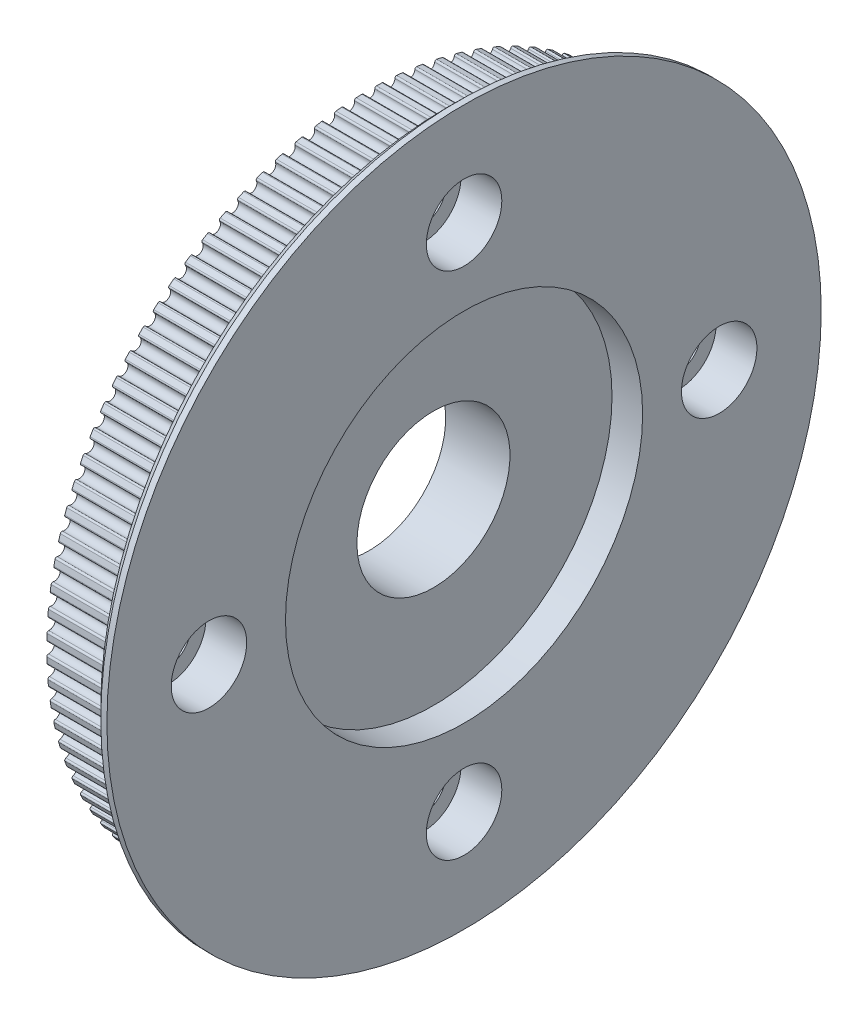
from build123d import *

# Parameters (mm, degrees)
SKETCH1_R           = 31.6
SKETCH1_R_2         = 7.5
BOSS_EXTRUDE1_DEPTH = 7.7
SKETCH2_R           = 0.55
CUT_EXTRUDE1_DEPTH  = 7.7
FILLET1_R           = 0.16
SKETCH3_R           = 35
SKETCH3_R_2         = 7.5
BOSS_EXTRUDE2_DEPTH = 1.6
SKETCH6_R           = 2.2
CUT_EXTRUDE6_DEPTH  = 9.3
SKETCH7_R           = 3.7
CUT_EXTRUDE4_DEPTH  = 4
CHAMFER1_SIZE       = 1
SKETCH8_R           = 17.5
CUT_EXTRUDE7_DEPTH  = 3


with BuildPart() as part:
    # Sketch1 → Boss-Extrude1 (new body)
    with BuildSketch(Plane(origin=(0, 0, 0), x_dir=(0, 0, -1), z_dir=(1, 0, 0))):
        with Locations(Location((0, 0, 0), (0, 0, 180))):
            Circle(SKETCH1_R)
        with Locations(Location((0, 0, 0), (0, 0, 180))):
            Circle(SKETCH1_R_2, mode=Mode.SUBTRACT)
    extrude(amount=BOSS_EXTRUDE1_DEPTH)

    # Sketch2 → Cut-Extrude1 (cut)
    with BuildSketch(Plane(origin=(0, 0, 0), x_dir=(0, 0, -1), z_dir=(1, 0, 0))):
        with Locations((0, 31.39)):
            Circle(SKETCH2_R)
        with Locations((1.970994408, 31.328059005)):
            Circle(SKETCH2_R)
        with Locations((3.934210202, 31.142480474)):
            Circle(SKETCH2_R)
        with Locations((5.881899465, 30.8339968)):
            Circle(SKETCH2_R)
        with Locations((7.806375558, 30.403825428)):
            Circle(SKETCH2_R)
        with Locations((9.700043453, 29.853664047)):
            Circle(SKETCH2_R)
        with Locations((11.555429709, 29.185683892)):
            Circle(SKETCH2_R)
        with Locations((13.365211962, 28.402521177)):
            Circle(SKETCH2_R)
        with Locations((15.12224783, 27.507266687)):
            Circle(SKETCH2_R)
        with Locations((16.819603094, 26.503453582)):
            Circle(SKETCH2_R)
        with Locations((18.450579069, 25.395043453)):
            Circle(SKETCH2_R)
        with Locations((20.008739038, 24.186410691)):
            Circle(SKETCH2_R)
        with Locations((21.487933655, 22.882325215)):
            Circle(SKETCH2_R)
        with Locations((22.882325215, 21.487933655)):
            Circle(SKETCH2_R)
        with Locations((24.186410691, 20.008739038)):
            Circle(SKETCH2_R)
        with Locations((25.395043453, 18.450579069)):
            Circle(SKETCH2_R)
        with Locations((26.503453582, 16.819603094)):
            Circle(SKETCH2_R)
        with Locations((27.507266687, 15.12224783)):
            Circle(SKETCH2_R)
        with Locations((28.402521177, 13.365211962)):
            Circle(SKETCH2_R)
        with Locations((29.185683892, 11.555429709)):
            Circle(SKETCH2_R)
        with Locations((29.853664047, 9.700043453)):
            Circle(SKETCH2_R)
        with Locations((30.403825428, 7.806375558)):
            Circle(SKETCH2_R)
        with Locations((30.8339968, 5.881899465)):
            Circle(SKETCH2_R)
        with Locations((31.142480474, 3.934210202)):
            Circle(SKETCH2_R)
        with Locations((31.328059005, 1.970994408)):
            Circle(SKETCH2_R)
        with Locations((31.39, 0)):
            Circle(SKETCH2_R)
        with Locations((31.328059005, -1.970994408)):
            Circle(SKETCH2_R)
        with Locations((31.142480474, -3.934210202)):
            Circle(SKETCH2_R)
        with Locations((30.8339968, -5.881899465)):
            Circle(SKETCH2_R)
        with Locations((30.403825428, -7.806375558)):
            Circle(SKETCH2_R)
        with Locations((29.853664047, -9.700043453)):
            Circle(SKETCH2_R)
        with Locations((29.185683892, -11.555429709)):
            Circle(SKETCH2_R)
        with Locations((28.402521177, -13.365211962)):
            Circle(SKETCH2_R)
        with Locations((27.507266687, -15.12224783)):
            Circle(SKETCH2_R)
        with Locations((26.503453582, -16.819603094)):
            Circle(SKETCH2_R)
        with Locations((25.395043453, -18.450579069)):
            Circle(SKETCH2_R)
        with Locations((24.186410691, -20.008739038)):
            Circle(SKETCH2_R)
        with Locations((22.882325215, -21.487933655)):
            Circle(SKETCH2_R)
        with Locations((21.487933655, -22.882325215)):
            Circle(SKETCH2_R)
        with Locations((20.008739038, -24.186410691)):
            Circle(SKETCH2_R)
        with Locations((18.450579069, -25.395043453)):
            Circle(SKETCH2_R)
        with Locations((16.819603094, -26.503453582)):
            Circle(SKETCH2_R)
        with Locations((15.12224783, -27.507266687)):
            Circle(SKETCH2_R)
        with Locations((13.365211962, -28.402521177)):
            Circle(SKETCH2_R)
        with Locations((11.555429709, -29.185683892)):
            Circle(SKETCH2_R)
        with Locations((9.700043453, -29.853664047)):
            Circle(SKETCH2_R)
        with Locations((7.806375558, -30.403825428)):
            Circle(SKETCH2_R)
        with Locations((5.881899465, -30.8339968)):
            Circle(SKETCH2_R)
        with Locations((3.934210202, -31.142480474)):
            Circle(SKETCH2_R)
        with Locations((1.970994408, -31.328059005)):
            Circle(SKETCH2_R)
        with Locations((0, -31.39)):
            Circle(SKETCH2_R)
        with Locations((-1.970994408, -31.328059005)):
            Circle(SKETCH2_R)
        with Locations((-3.934210202, -31.142480474)):
            Circle(SKETCH2_R)
        with Locations((-5.881899465, -30.8339968)):
            Circle(SKETCH2_R)
        with Locations((-7.806375558, -30.403825428)):
            Circle(SKETCH2_R)
        with Locations((-9.700043453, -29.853664047)):
            Circle(SKETCH2_R)
        with Locations((-11.555429709, -29.185683892)):
            Circle(SKETCH2_R)
        with Locations((-13.365211962, -28.402521177)):
            Circle(SKETCH2_R)
        with Locations((-15.12224783, -27.507266687)):
            Circle(SKETCH2_R)
        with Locations((-16.819603094, -26.503453582)):
            Circle(SKETCH2_R)
        with Locations((-18.450579069, -25.395043453)):
            Circle(SKETCH2_R)
        with Locations((-20.008739038, -24.186410691)):
            Circle(SKETCH2_R)
        with Locations((-21.487933655, -22.882325215)):
            Circle(SKETCH2_R)
        with Locations((-22.882325215, -21.487933655)):
            Circle(SKETCH2_R)
        with Locations((-24.186410691, -20.008739038)):
            Circle(SKETCH2_R)
        with Locations((-25.395043453, -18.450579069)):
            Circle(SKETCH2_R)
        with Locations((-26.503453582, -16.819603094)):
            Circle(SKETCH2_R)
        with Locations((-27.507266687, -15.12224783)):
            Circle(SKETCH2_R)
        with Locations((-28.402521177, -13.365211962)):
            Circle(SKETCH2_R)
        with Locations((-29.185683892, -11.555429709)):
            Circle(SKETCH2_R)
        with Locations((-29.853664047, -9.700043453)):
            Circle(SKETCH2_R)
        with Locations((-30.403825428, -7.806375558)):
            Circle(SKETCH2_R)
        with Locations((-30.8339968, -5.881899465)):
            Circle(SKETCH2_R)
        with Locations((-31.142480474, -3.934210202)):
            Circle(SKETCH2_R)
        with Locations((-31.328059005, -1.970994408)):
            Circle(SKETCH2_R)
        with Locations((-31.39, 0)):
            Circle(SKETCH2_R)
        with Locations((-31.328059005, 1.970994408)):
            Circle(SKETCH2_R)
        with Locations((-31.142480474, 3.934210202)):
            Circle(SKETCH2_R)
        with Locations((-30.8339968, 5.881899465)):
            Circle(SKETCH2_R)
        with Locations((-30.403825428, 7.806375558)):
            Circle(SKETCH2_R)
        with Locations((-29.853664047, 9.700043453)):
            Circle(SKETCH2_R)
        with Locations((-29.185683892, 11.555429709)):
            Circle(SKETCH2_R)
        with Locations((-28.402521177, 13.365211962)):
            Circle(SKETCH2_R)
        with Locations((-27.507266687, 15.12224783)):
            Circle(SKETCH2_R)
        with Locations((-26.503453582, 16.819603094)):
            Circle(SKETCH2_R)
        with Locations((-25.395043453, 18.450579069)):
            Circle(SKETCH2_R)
        with Locations((-24.186410691, 20.008739038)):
            Circle(SKETCH2_R)
        with Locations((-22.882325215, 21.487933655)):
            Circle(SKETCH2_R)
        with Locations((-21.487933655, 22.882325215)):
            Circle(SKETCH2_R)
        with Locations((-20.008739038, 24.186410691)):
            Circle(SKETCH2_R)
        with Locations((-18.450579069, 25.395043453)):
            Circle(SKETCH2_R)
        with Locations((-16.819603094, 26.503453582)):
            Circle(SKETCH2_R)
        with Locations((-15.12224783, 27.507266687)):
            Circle(SKETCH2_R)
        with Locations((-13.365211962, 28.402521177)):
            Circle(SKETCH2_R)
        with Locations((-11.555429709, 29.185683892)):
            Circle(SKETCH2_R)
        with Locations((-9.700043453, 29.853664047)):
            Circle(SKETCH2_R)
        with Locations((-7.806375558, 30.403825428)):
            Circle(SKETCH2_R)
        with Locations((-5.881899465, 30.8339968)):
            Circle(SKETCH2_R)
        with Locations((-3.934210202, 31.142480474)):
            Circle(SKETCH2_R)
        with Locations((-1.970994408, 31.328059005)):
            Circle(SKETCH2_R)
    extrude(amount=CUT_EXTRUDE1_DEPTH, mode=Mode.SUBTRACT)

    # Fillet1
    fillet1_edges = [part.edges().sort_by_distance(p)[0] for p in [
        (3.85, 31.59588404, 0.510011532),
        (3.85, 31.59588404, -0.510011532),
        (3.85, 31.501512891, 2.492927114),
        (3.85, 31.565560669, 1.474916834),
        (3.85, 31.282819662, 4.466004252),
        (3.85, 31.410662451, 3.454024376),
        (3.85, 30.940667436, 6.421456112),
        (3.85, 31.131800699, 5.419500462),
        (3.85, 30.476406531, 8.351565418),
        (3.85, 30.730075952, 7.363588255),
        (3.85, 29.891869173, 10.248714911),
        (3.85, 30.207073634, 9.27861533),
        (3.85, 29.189362264, 12.105417408),
        (3.85, 29.564857798, 11.157023949),
        (3.85, 28.371658277, 13.914345353),
        (3.85, 28.805962974, 12.991400892),
        (3.85, 27.441984317, 15.668359734),
        (3.85, 27.933384175, 14.774506711),
        (3.85, 26.404009381, 17.360538258),
        (3.85, 26.95056507, 16.499304301),
        (3.85, 25.261829884, 18.984202668),
        (3.85, 25.861384397, 18.158986675),
        (3.85, 24.019953484, 20.532945103),
        (3.85, 24.670140655, 19.747003825),
        (3.85, 22.683281303, 22.000653385),
        (3.85, 23.381535138, 21.257088572),
        (3.85, 21.257088572, 23.381535138),
        (3.85, 22.000653385, 22.683281303),
        (3.85, 19.747003825, 24.670140655),
        (3.85, 20.532945103, 24.019953484),
        (3.85, 18.158986675, 25.861384397),
        (3.85, 18.984202668, 25.261829884),
        (3.85, 16.499304301, 26.95056507),
        (3.85, 17.360538258, 26.404009381),
        (3.85, 14.774506711, 27.933384175),
        (3.85, 15.668359734, 27.441984317),
        (3.85, 12.991400892, 28.805962974),
        (3.85, 13.914345353, 28.371658277),
        (3.85, 11.157023949, 29.564857798),
        (3.85, 12.105417408, 29.189362264),
        (3.85, 9.27861533, 30.207073634),
        (3.85, 10.248714911, 29.891869173),
        (3.85, 7.363588255, 30.730075952),
        (3.85, 8.351565418, 30.476406531),
        (3.85, 5.419500462, 31.131800699),
        (3.85, 6.421456112, 30.940667436),
        (3.85, 3.454024376, 31.410662451),
        (3.85, 4.466004252, 31.282819662),
        (3.85, 1.474916834, 31.565560669),
        (3.85, 2.492927114, 31.501512891),
        (3.85, -0.510011532, 31.59588404),
        (3.85, 0.510011532, 31.59588404),
        (3.85, -2.492927114, 31.501512891),
        (3.85, -1.474916834, 31.565560669),
        (3.85, -4.466004252, 31.282819662),
        (3.85, -3.454024376, 31.410662451),
        (3.85, -6.421456112, 30.940667436),
        (3.85, -5.419500462, 31.131800699),
        (3.85, -8.351565418, 30.476406531),
        (3.85, -7.363588255, 30.730075952),
        (3.85, -10.248714911, 29.891869173),
        (3.85, -9.27861533, 30.207073634),
        (3.85, -12.105417408, 29.189362264),
        (3.85, -11.157023949, 29.564857798),
        (3.85, -13.914345353, 28.371658277),
        (3.85, -12.991400892, 28.805962974),
        (3.85, -15.668359734, 27.441984317),
        (3.85, -14.774506711, 27.933384175),
        (3.85, -17.360538258, 26.404009381),
        (3.85, -16.499304301, 26.95056507),
        (3.85, -18.984202668, 25.261829884),
        (3.85, -18.158986675, 25.861384397),
        (3.85, -20.532945103, 24.019953484),
        (3.85, -19.747003825, 24.670140655),
        (3.85, -22.000653385, 22.683281303),
        (3.85, -21.257088572, 23.381535138),
        (3.85, -23.381535138, 21.257088572),
        (3.85, -22.683281303, 22.000653385),
        (3.85, -24.670140655, 19.747003825),
        (3.85, -24.019953484, 20.532945103),
        (3.85, -25.861384397, 18.158986675),
        (3.85, -25.261829884, 18.984202668),
        (3.85, -26.95056507, 16.499304301),
        (3.85, -26.404009381, 17.360538258),
        (3.85, -27.933384175, 14.774506711),
        (3.85, -27.441984317, 15.668359734),
        (3.85, -28.805962974, 12.991400892),
        (3.85, -28.371658277, 13.914345353),
        (3.85, -29.564857798, 11.157023949),
        (3.85, -29.189362264, 12.105417408),
        (3.85, -30.207073634, 9.27861533),
        (3.85, -29.891869173, 10.248714911),
        (3.85, -30.730075952, 7.363588255),
        (3.85, -30.476406531, 8.351565418),
        (3.85, -31.131800699, 5.419500462),
        (3.85, -30.940667436, 6.421456112),
        (3.85, -31.410662451, 3.454024376),
        (3.85, -31.282819662, 4.466004252),
        (3.85, -31.565560669, 1.474916834),
        (3.85, -31.501512891, 2.492927114),
        (3.85, -31.59588404, -0.510011532),
        (3.85, -31.59588404, 0.510011532),
        (3.85, -31.501512891, -2.492927114),
        (3.85, -31.565560669, -1.474916834),
        (3.85, -31.282819662, -4.466004252),
        (3.85, -31.410662451, -3.454024376),
        (3.85, -30.940667436, -6.421456112),
        (3.85, -31.131800699, -5.419500462),
        (3.85, -30.476406531, -8.351565418),
        (3.85, -30.730075952, -7.363588255),
        (3.85, -29.891869173, -10.248714911),
        (3.85, -30.207073634, -9.27861533),
        (3.85, -29.189362264, -12.105417408),
        (3.85, -29.564857798, -11.157023949),
        (3.85, -28.371658277, -13.914345353),
        (3.85, -28.805962974, -12.991400892),
        (3.85, -27.441984317, -15.668359734),
        (3.85, -27.933384175, -14.774506711),
        (3.85, -26.404009381, -17.360538258),
        (3.85, -26.95056507, -16.499304301),
        (3.85, -25.261829884, -18.984202668),
        (3.85, -25.861384397, -18.158986675),
        (3.85, -24.019953484, -20.532945103),
        (3.85, -24.670140655, -19.747003825),
        (3.85, -22.683281303, -22.000653385),
        (3.85, -23.381535138, -21.257088572),
        (3.85, -21.257088572, -23.381535138),
        (3.85, -22.000653385, -22.683281303),
        (3.85, -19.747003825, -24.670140655),
        (3.85, -20.532945103, -24.019953484),
        (3.85, -18.158986675, -25.861384397),
        (3.85, -18.984202668, -25.261829884),
        (3.85, -16.499304301, -26.95056507),
        (3.85, -17.360538258, -26.404009381),
        (3.85, -14.774506711, -27.933384175),
        (3.85, -15.668359734, -27.441984317),
        (3.85, -12.991400892, -28.805962974),
        (3.85, -13.914345353, -28.371658277),
        (3.85, -11.157023949, -29.564857798),
        (3.85, -12.105417408, -29.189362264),
        (3.85, -9.27861533, -30.207073634),
        (3.85, -10.248714911, -29.891869173),
        (3.85, -7.363588255, -30.730075952),
        (3.85, -8.351565418, -30.476406531),
        (3.85, -5.419500462, -31.131800699),
        (3.85, -6.421456112, -30.940667436),
        (3.85, -3.454024376, -31.410662451),
        (3.85, -4.466004252, -31.282819662),
        (3.85, -1.474916834, -31.565560669),
        (3.85, -2.492927114, -31.501512891),
        (3.85, 0.510011532, -31.59588404),
        (3.85, -0.510011532, -31.59588404),
        (3.85, 2.492927114, -31.501512891),
        (3.85, 1.474916834, -31.565560669),
        (3.85, 4.466004252, -31.282819662),
        (3.85, 3.454024376, -31.410662451),
        (3.85, 6.421456112, -30.940667436),
        (3.85, 5.419500462, -31.131800699),
        (3.85, 8.351565418, -30.476406531),
        (3.85, 7.363588255, -30.730075952),
        (3.85, 10.248714911, -29.891869173),
        (3.85, 9.27861533, -30.207073634),
        (3.85, 12.105417408, -29.189362264),
        (3.85, 11.157023949, -29.564857798),
        (3.85, 13.914345353, -28.371658277),
        (3.85, 12.991400892, -28.805962974),
        (3.85, 15.668359734, -27.441984317),
        (3.85, 14.774506711, -27.933384175),
        (3.85, 17.360538258, -26.404009381),
        (3.85, 16.499304301, -26.95056507),
        (3.85, 18.984202668, -25.261829884),
        (3.85, 18.158986675, -25.861384397),
        (3.85, 20.532945103, -24.019953484),
        (3.85, 19.747003825, -24.670140655),
        (3.85, 22.000653385, -22.683281303),
        (3.85, 21.257088572, -23.381535138),
        (3.85, 23.381535138, -21.257088572),
        (3.85, 22.683281303, -22.000653385),
        (3.85, 24.670140655, -19.747003825),
        (3.85, 24.019953484, -20.532945103),
        (3.85, 25.861384397, -18.158986675),
        (3.85, 25.261829884, -18.984202668),
        (3.85, 26.95056507, -16.499304301),
        (3.85, 26.404009381, -17.360538258),
        (3.85, 27.933384175, -14.774506711),
        (3.85, 27.441984317, -15.668359734),
        (3.85, 28.805962974, -12.991400892),
        (3.85, 28.371658277, -13.914345353),
        (3.85, 29.564857798, -11.157023949),
        (3.85, 29.189362264, -12.105417408),
        (3.85, 30.207073634, -9.27861533),
        (3.85, 29.891869173, -10.248714911),
        (3.85, 30.730075952, -7.363588255),
        (3.85, 30.476406531, -8.351565418),
        (3.85, 31.131800699, -5.419500462),
        (3.85, 30.940667436, -6.421456112),
        (3.85, 31.410662451, -3.454024376),
        (3.85, 31.282819662, -4.466004252),
        (3.85, 31.565560669, -1.474916834),
        (3.85, 31.501512891, -2.492927114),
    ]]
    fillet(fillet1_edges, radius=FILLET1_R)

    # Sketch3 → Boss-Extrude2 (add)
    with BuildSketch(Plane(origin=(7.7, 0, 0), x_dir=(0, 0, -1), z_dir=(1, 0, 0))):
        Circle(SKETCH3_R)
        with Locations(Location((0, 0, 0), (0, 0, 180))):
            Circle(SKETCH3_R_2, mode=Mode.SUBTRACT)
    extrude(amount=BOSS_EXTRUDE2_DEPTH)

    # Sketch6 → Cut-Extrude6 (cut)
    with BuildSketch(Plane(origin=(9.3, 0, 0), x_dir=(0, 0, -1), z_dir=(1, 0, 0))):
        with Locations((0, -25)):
            Circle(SKETCH6_R)
        with Locations((-25, 0)):
            Circle(SKETCH6_R)
        with Locations((0, 25)):
            Circle(SKETCH6_R)
        with Locations((25, 0)):
            Circle(SKETCH6_R)
    extrude(amount=-CUT_EXTRUDE6_DEPTH, mode=Mode.SUBTRACT)

    # Sketch7 → Cut-Extrude4 (cut)
    with BuildSketch(Plane(origin=(9.3, 0, 0), x_dir=(0, 0, -1), z_dir=(1, 0, 0))):
        with Locations((0, -25)):
            Circle(SKETCH7_R)
        with Locations((-25, 0)):
            Circle(SKETCH7_R)
        with Locations((0, 25)):
            Circle(SKETCH7_R)
        with Locations((25, 0)):
            Circle(SKETCH7_R)
    extrude(amount=-CUT_EXTRUDE4_DEPTH, mode=Mode.SUBTRACT)

    # Chamfer1
    chamfer1_edges = [part.edges().sort_by_distance(p)[0] for p in [
        (7.7, 0, 35),
    ]]
    chamfer(chamfer1_edges, length=CHAMFER1_SIZE)

    # Sketch8 → Cut-Extrude7 (cut)
    with BuildSketch(Plane(origin=(9.3, 0, 0), x_dir=(0, 0, -1), z_dir=(1, 0, 0))):
        Circle(SKETCH8_R)
    extrude(amount=-CUT_EXTRUDE7_DEPTH, mode=Mode.SUBTRACT)


solid = part.part
